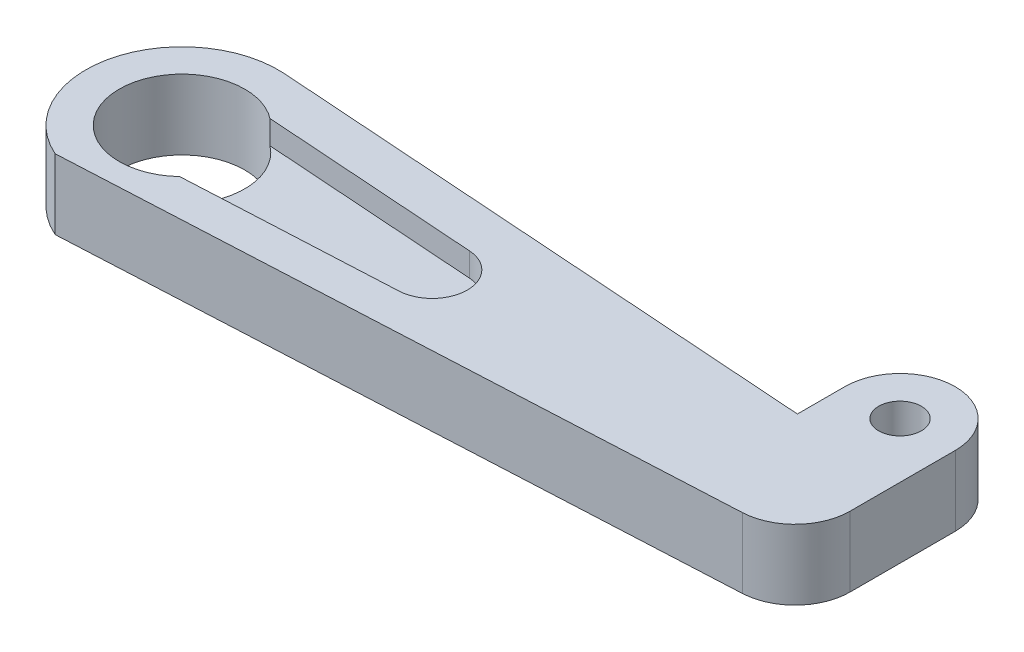
from build123d import *

# Parameters (mm, degrees)
BOSS_EXTRUDE1_START    = -1.35
BOSS_EXTRUDE1_DEPTH    = 1.35
SKETCH4_R              = 1.2192
BOSS_EXTRUDE2_DEPTH    = 4
BODY_DELETE1_OUTLINE_R = 2.45
BODY_DELETE1_DEPTH     = 4


# Read off the part's stored shape, not the designer's step: Body-Delete1
with BuildPart() as part:
    # Sketch2 → Revolve1 (revolve)
    with BuildSketch(Plane.XY, mode=Mode.PRIVATE) as revolve1_sk:
        Polygon((2.45, 0), (2.45, 2.25), (1.2, 2.25), (1.2, 3), (2.45, 3), (2.45, 4), (3.585, 4), (3.585, 0), align=None)
    revolve(revolve1_sk.sketch.rotate(Axis((0, 0, 0), (0, 1, 0)), 90), axis=Axis((0, 0, 0), (0, 1, 0)))

    # Sketch3 → Boss-Extrude1 (add)
    with BuildSketch(Plane(origin=(0, 4, 0), x_dir=(1, 0, 0), z_dir=(0, 1, 0)).offset(BOSS_EXTRUDE1_START)):
        with BuildLine():
            Line((2.174793094, 2.85), (14.4288372, 1.998853492))
            ThreePointArc((14.4288372, 1.998853492), (16.293577458, -0.019194273), (14.390517199, -2.001146508))
            Line((14.390517199, -2.001146508), (2.468243302, -2.6))
            ThreePointArc((2.468243302, -2.6), (3.579814485, 0.1927518), (2.174793094, 2.85))
        make_face()
    extrude(amount=BOSS_EXTRUDE1_DEPTH)


with BuildPart() as body_2:
    # Sketch4 → Boss-Extrude2 (new body)
    with BuildSketch(Plane(origin=(0, 0, 0), x_dir=(1, 0, 0), z_dir=(0, 1, 0))):
        with BuildLine():
            Line((0.380676568, 5.480639828), (31.845967375, 3.295110532))
            Line((31.845967375, 3.295110532), (31.845967375, 6))
            ThreePointArc((31.845967375, 6), (35, 9.154032625), (38.154032625, 6))
            Line((38.154032625, 6), (38.154032625, 0))
            ThreePointArc((38.154032625, 0), (37.285495002, -2.173576407), (35.158226963, -3.150061274))
            Line((35.158226963, -3.150061274), (-2.215454853, -5.027334022))
            ThreePointArc((-2.215454853, -5.027334022), (-5.333477425, 1.317704871), (0.380676568, 5.480639828))
        make_face()
        with Locations(Location((35, 6, 0), (0, 0, 270))):
            Circle(SKETCH4_R, mode=Mode.SUBTRACT)
    extrude(amount=BOSS_EXTRUDE2_DEPTH)

    # Combine1: cut part
    add(part.part, mode=Mode.SUBTRACT)

    # Body-Delete1 outline → Body-Delete1 (cut)
    with BuildSketch(Plane(origin=(0, 0, 0), x_dir=(1, 0, 0), z_dir=(0, 1, 0))):
        Circle(BODY_DELETE1_OUTLINE_R)
    extrude(amount=BODY_DELETE1_DEPTH, mode=Mode.SUBTRACT)


solid = body_2.part
